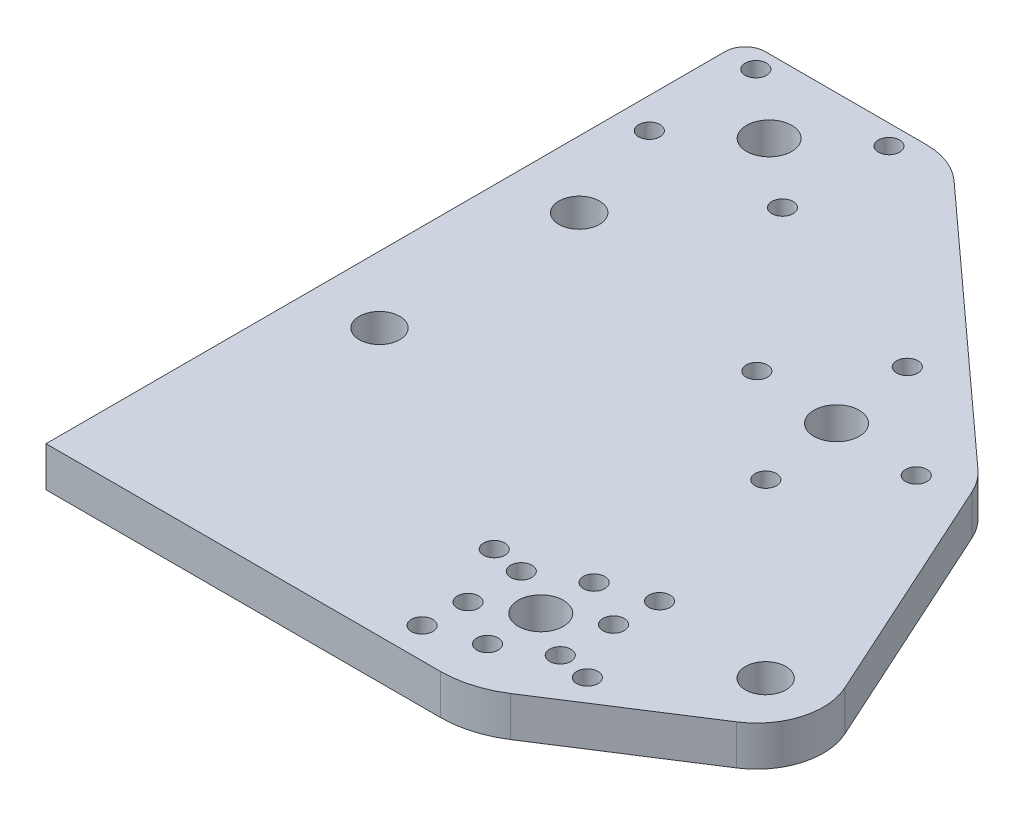
from build123d import *

# Parameters (mm, degrees)
ESBO_O1_R                = 1.6
ESBO_O1_R_2              = 3.05
ESBO_O1_R_3              = 3.4
RESSALTO_EXTRUS_O1_DEPTH = 6
ESBO_O2_R                = 3.05
CORTE_EXTRUS_O1_DEPTH    = 10


with BuildPart() as part:
    # Esboço1 → Ressalto-extrusão1 (new body)
    with BuildSketch(Plane.XZ.offset(6)):
        with BuildLine():
            Line((151.235707119, -14.290882553), (167.194797105, 20.786465148))
            ThreePointArc((167.194797105, 20.786465148), (167.685761246, 27.750971942), (163.500492529, 33.339256691))
            Line((163.500492529, 33.339256691), (142.828802448, 46.629356782))
            ThreePointArc((142.828802448, 46.629356782), (138.919887467, 48.41513057), (134.666145804, 49.026919929))
            Line((134.666145804, 49.026919929), (75.43742995, 49.026919929))
            Line((75.43742995, 49.026919929), (75.43742995, -53))
            ThreePointArc((75.43742995, -53), (76.316109606, -55.121320344), (78.43742995, -56))
            Line((78.43742995, -56), (102.684651367, -56))
            ThreePointArc((102.684651367, -56), (106.289825387, -55.327524875), (109.410121436, -53.400544058))
            Line((109.410121436, -53.400544058), (148.858963728, -17.550205761))
            ThreePointArc((148.858963728, -17.550205761), (150.213387743, -16.041631797), (151.235707119, -14.290882553))
        make_face()
        with Locations((119.376459837, -13.805034822)):
            Circle(ESBO_O1_R, mode=Mode.SUBTRACT)
        with Locations((146.515369336, 38.790557081)):
            Circle(ESBO_O1_R, mode=Mode.SUBTRACT)
        with Locations((142.006279058, 23.439071652)):
            Circle(ESBO_O1_R, mode=Mode.SUBTRACT)
        with Locations((159.995304814, 25.487659571)):
            Circle(ESBO_O1_R_2, mode=Mode.SUBTRACT)
        with Locations((100.03742995, -37)):
            Circle(ESBO_O1_R, mode=Mode.SUBTRACT)
        with Locations((100.03742995, -53)):
            Circle(ESBO_O1_R, mode=Mode.SUBTRACT)
        with Locations((80.03742995, -37)):
            Circle(ESBO_O1_R, mode=Mode.SUBTRACT)
        with Locations((80.03742995, -53)):
            Circle(ESBO_O1_R, mode=Mode.SUBTRACT)
        with Locations((122.816922272, 29.0754345)):
            Circle(ESBO_O1_R, mode=Mode.SUBTRACT)
        with Locations((127.326012551, 44.426919929)):
            Circle(ESBO_O1_R, mode=Mode.SUBTRACT)
        with Locations((130.137211947, -25.645905315)):
            Circle(ESBO_O1_R, mode=Mode.SUBTRACT)
        with Locations((144.938300063, -12.194965178)):
            Circle(ESBO_O1_R, mode=Mode.SUBTRACT)
        with Locations((134.177547953, -0.354094685)):
            Circle(ESBO_O1_R, mode=Mode.SUBTRACT)
        with Locations((141.594349035, 29.932995791)):
            Circle(ESBO_O1_R, mode=Mode.SUBTRACT)
        with Locations((134.666145804, 25.932995791)):
            Circle(ESBO_O1_R, mode=Mode.SUBTRACT)
        with Locations((127.737942574, 29.932995791)):
            Circle(ESBO_O1_R, mode=Mode.SUBTRACT)
        with Locations((127.737942574, 37.932995791)):
            Circle(ESBO_O1_R, mode=Mode.SUBTRACT)
        with Locations((134.666145804, 41.932995791)):
            Circle(ESBO_O1_R, mode=Mode.SUBTRACT)
        with Locations((141.594349035, 37.932995791)):
            Circle(ESBO_O1_R, mode=Mode.SUBTRACT)
        with Locations((134.666145804, 33.932995791)):
            Circle(ESBO_O1_R_3, mode=Mode.SUBTRACT)
        with Locations((132.15737995, -13)):
            Circle(ESBO_O1_R_3, mode=Mode.SUBTRACT)
        with Locations((90.03742995, -45)):
            Circle(ESBO_O1_R_3, mode=Mode.SUBTRACT)
    extrude(amount=-RESSALTO_EXTRUS_O1_DEPTH)

    # Esboço2 → Corte-extrusão1 (cut)
    with BuildSketch(Plane.XZ.offset(6)):
        with Locations((85.43742995, 8.932995791)):
            Circle(ESBO_O2_R)
        with Locations((85.43742995, -21.067004209)):
            Circle(ESBO_O2_R)
    extrude(amount=-CORTE_EXTRUS_O1_DEPTH, mode=Mode.SUBTRACT)


solid = part.part
